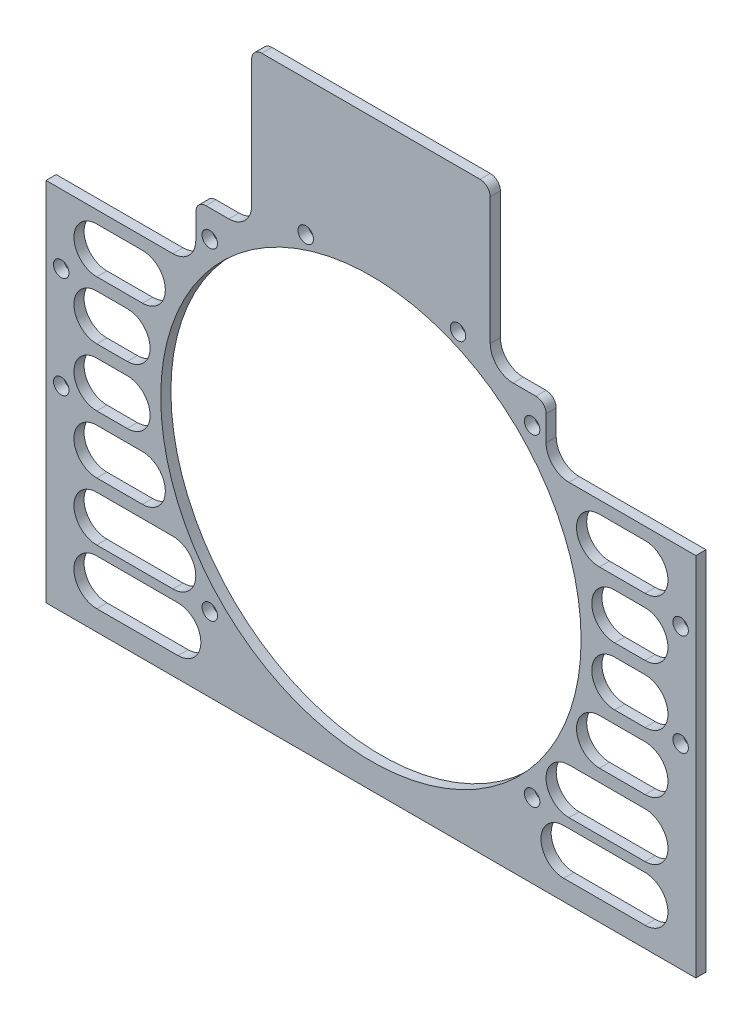
from build123d import *

# Parameters (mm, degrees)
SKETCH_1_W          = 128
SKETCH_1_H          = 115
SKETCH_1_R          = 1.525
EXTRUDE_1_DEPTH     = 2
SKETCH_2_R          = 41.4
CUT_EXTRUDE_1_DEPTH = 10
SKETCH_3_R          = 1.525
CUT_EXTRUDE_2_DEPTH = 10
CUT_EXTRUDE_3_DEPTH = 10
CUT_EXTRUDE_4_DEPTH = 10
FILLET_1_R          = 2


with BuildPart() as part:
    # 草图1 → 凸台-拉伸1 (new body)
    with BuildSketch(Plane.XY):
        with Locations((64, 57.5)):
            Rectangle(SKETCH_1_W, SKETCH_1_H)
        with Locations((3, 58.5)):
            Circle(SKETCH_1_R, mode=Mode.SUBTRACT)
        with Locations((3, 38.5)):
            Circle(SKETCH_1_R, mode=Mode.SUBTRACT)
        with Locations((125, 38.5)):
            Circle(SKETCH_1_R, mode=Mode.SUBTRACT)
        with Locations((125, 58.5)):
            Circle(SKETCH_1_R, mode=Mode.SUBTRACT)
    extrude(amount=EXTRUDE_1_DEPTH)

    # 草图2 → 切除-拉伸1 (cut)
    with BuildSketch(Plane.XY.offset(2)):
        with Locations((64, 46.4)):
            Circle(SKETCH_2_R)
    extrude(amount=-CUT_EXTRUDE_1_DEPTH, mode=Mode.SUBTRACT)

    # 草图3 → 切除-拉伸2 (cut)
    with BuildSketch(Plane(origin=(0, 0, 0), x_dir=(-1, 0, 0), z_dir=(0, 0, -1))):
        with Locations((-81.153096541, 86.810163067)):
            Circle(SKETCH_3_R)
        with Locations((-51.164882163, 88.381778787)):
            Circle(SKETCH_3_R)
        with Locations((-95.749094475, 78.149094475)):
            Circle(SKETCH_3_R)
        with Locations((-32.250905525, 78.149094475)):
            Circle(SKETCH_3_R)
        with Locations((-32.250905525, 14.650905525)):
            Circle(SKETCH_3_R)
        with Locations((-95.749094475, 14.650905525)):
            Circle(SKETCH_3_R)
    extrude(amount=-CUT_EXTRUDE_2_DEPTH, mode=Mode.SUBTRACT)

    # 草图4 → 切除-拉伸3 (cut)
    with BuildSketch(Plane(origin=(0, 0, 0), x_dir=(-1, 0, 0), z_dir=(0, 0, -1))):
        with BuildLine():
            Line((-118, 92.5), (-92, 92.5))
            ThreePointArc((-92, 92.5), (-87.5, 88), (-92, 83.5))
            Line((-92, 83.5), (-118, 83.5))
            ThreePointArc((-118, 83.5), (-122.5, 88), (-118, 92.5))
        make_face()
        with BuildLine():
            Line((-118, 81.05952381), (-103, 81.05952381))
            ThreePointArc((-103, 81.05952381), (-98.5, 76.55952381), (-103, 72.05952381))
            Line((-103, 72.05952381), (-118, 72.05952381))
            ThreePointArc((-118, 72.05952381), (-122.5, 76.55952381), (-118, 81.05952381))
        make_face()
        with BuildLine():
            Line((-118, 69.619047619), (-109, 69.619047619))
            ThreePointArc((-109, 69.619047619), (-104.5, 65.119047619), (-109, 60.619047619))
            Line((-109, 60.619047619), (-118, 60.619047619))
            ThreePointArc((-118, 60.619047619), (-122.5, 65.119047619), (-118, 69.619047619))
        make_face()
        with BuildLine():
            Line((-118, 58.178571429), (-112, 58.178571429))
            ThreePointArc((-112, 58.178571429), (-107.5, 53.678571429), (-112, 49.178571429))
            Line((-112, 49.178571429), (-118, 49.178571429))
            ThreePointArc((-118, 49.178571429), (-122.5, 53.678571429), (-118, 58.178571429))
        make_face()
        with BuildLine():
            Line((-118, 4), (-102, 4))
            ThreePointArc((-102, 4), (-97.5, 8.5), (-102, 13))
            Line((-102, 13), (-118, 13))
            ThreePointArc((-118, 13), (-122.5, 8.5), (-118, 4))
        make_face()
        with BuildLine():
            Line((-118, 14.857142857), (-103, 14.857142857))
            ThreePointArc((-103, 14.857142857), (-98.5, 19.357142857), (-103, 23.857142857))
            Line((-103, 23.857142857), (-118, 23.857142857))
            ThreePointArc((-118, 23.857142857), (-122.5, 19.357142857), (-118, 14.857142857))
        make_face()
        with BuildLine():
            Line((-118, 26.297619048), (-109, 26.297619048))
            ThreePointArc((-109, 26.297619048), (-104.5, 30.797619048), (-109, 35.297619048))
            Line((-109, 35.297619048), (-118, 35.297619048))
            ThreePointArc((-118, 35.297619048), (-122.5, 30.797619048), (-118, 26.297619048))
        make_face()
        with BuildLine():
            Line((-118, 37.738095238), (-112, 37.738095238))
            ThreePointArc((-112, 37.738095238), (-107.5, 42.238095238), (-112, 46.738095238))
            Line((-112, 46.738095238), (-118, 46.738095238))
            ThreePointArc((-118, 46.738095238), (-122.5, 42.238095238), (-118, 37.738095238))
        make_face()
        with BuildLine():
            Line((-10, 92.5), (-36, 92.5))
            ThreePointArc((-36, 92.5), (-40.5, 88), (-36, 83.5))
            Line((-36, 83.5), (-10, 83.5))
            ThreePointArc((-10, 83.5), (-5.5, 88), (-10, 92.5))
        make_face()
        with BuildLine():
            Line((-10, 81.05952381), (-25, 81.05952381))
            ThreePointArc((-25, 81.05952381), (-29.5, 76.55952381), (-25, 72.05952381))
            Line((-25, 72.05952381), (-10, 72.05952381))
            ThreePointArc((-10, 72.05952381), (-5.5, 76.55952381), (-10, 81.05952381))
        make_face()
        with BuildLine():
            Line((-10, 69.619047619), (-19, 69.619047619))
            ThreePointArc((-19, 69.619047619), (-23.5, 65.119047619), (-19, 60.619047619))
            Line((-19, 60.619047619), (-10, 60.619047619))
            ThreePointArc((-10, 60.619047619), (-5.5, 65.119047619), (-10, 69.619047619))
        make_face()
        with BuildLine():
            Line((-10, 58.178571429), (-16, 58.178571429))
            ThreePointArc((-16, 58.178571429), (-20.5, 53.678571429), (-16, 49.178571429))
            Line((-16, 49.178571429), (-10, 49.178571429))
            ThreePointArc((-10, 49.178571429), (-5.5, 53.678571429), (-10, 58.178571429))
        make_face()
        with BuildLine():
            Line((-10, 4), (-26, 4))
            ThreePointArc((-26, 4), (-30.5, 8.5), (-26, 13))
            Line((-26, 13), (-10, 13))
            ThreePointArc((-10, 13), (-5.5, 8.5), (-10, 4))
        make_face()
        with BuildLine():
            Line((-10, 14.857142857), (-25, 14.857142857))
            ThreePointArc((-25, 14.857142857), (-29.5, 19.357142857), (-25, 23.857142857))
            Line((-25, 23.857142857), (-10, 23.857142857))
            ThreePointArc((-10, 23.857142857), (-5.5, 19.357142857), (-10, 14.857142857))
        make_face()
        with BuildLine():
            Line((-10, 26.297619048), (-19, 26.297619048))
            ThreePointArc((-19, 26.297619048), (-23.5, 30.797619048), (-19, 35.297619048))
            Line((-19, 35.297619048), (-10, 35.297619048))
            ThreePointArc((-10, 35.297619048), (-5.5, 30.797619048), (-10, 26.297619048))
        make_face()
        with BuildLine():
            Line((-10, 37.738095238), (-16, 37.738095238))
            ThreePointArc((-16, 37.738095238), (-20.5, 42.238095238), (-16, 46.738095238))
            Line((-16, 46.738095238), (-10, 46.738095238))
            ThreePointArc((-10, 46.738095238), (-5.5, 42.238095238), (-10, 37.738095238))
        make_face()
    extrude(amount=-CUT_EXTRUDE_3_DEPTH, mode=Mode.SUBTRACT)

    # 草图5 → 切除-拉伸4 (cut)
    with BuildSketch(Plane(origin=(0, 0, 0), x_dir=(-1, 0, 0), z_dir=(0, 0, -1))):
        Polygon((-98.5, 76.55952381), (-98.5, 83.5), (-87.5, 88), (-87.5, 115), (-128, 115), (-128, 72.05952381), (-103, 72.05952381), align=None)
        Polygon((-25, 72.05952381), (-29.5, 76.55952381), (-29.5, 83.5), (-40.5, 88), (-40.5, 115), (0, 115), (0, 72.05952381), align=None)
    extrude(amount=-CUT_EXTRUDE_4_DEPTH, mode=Mode.SUBTRACT)

    # 圆角1
    fillet_1_edges = [part.edges().sort_by_distance(p)[0] for p in [
        (29.5, 83.5, 1),
        (40.5, 115, 1),
        (87.5, 115, 1),
        (98.5, 83.5, 1),
    ]]
    fillet(fillet_1_edges, radius=FILLET_1_R)


solid = part.part
